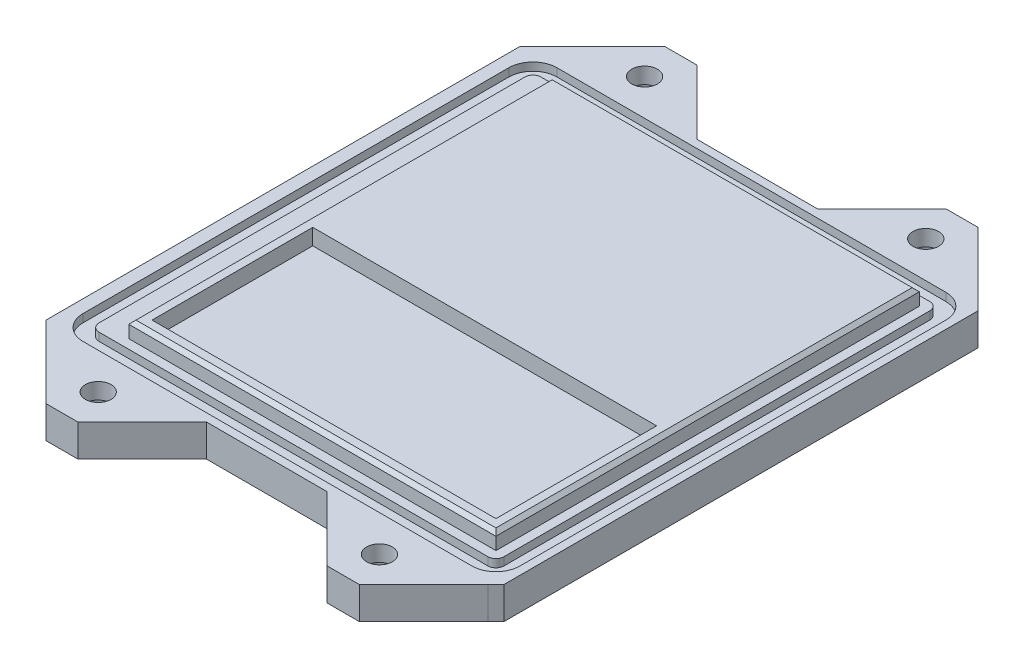
from build123d import *
from build123d.topology import SkipClean

# Parameters (mm, degrees)
SKETCH2_W           = 56
SKETCH2_H           = 61
BOSS_EXTRUDE1_DEPTH = 2
SKETCH3_W           = 46
SKETCH3_H           = 53
BOSS_EXTRUDE4_DEPTH = 2
SKETCH4_W           = 61
SKETCH4_H           = 4
BOSS_EXTRUDE5_DEPTH = 1
SKETCH5_W           = 6
SKETCH5_H           = 7
SKETCH5_R           = 1.6
BOSS_EXTRUDE7_DEPTH = 4
CUT_EXTRUDE1_DEPTH  = 1
CHAMFER1_SIZE       = 7
CHAMFER2_SIZE       = 7
CHAMFER3_SIZE       = 7
SKETCH11_R          = 3.1
CUT_EXTRUDE3_DEPTH  = 2
CHAMFER5_SIZE       = 1
BOSS_EXTRUDE8_DEPTH = 4
SKETCH13_W          = 45.8
SKETCH13_H          = 52.8
CUT_EXTRUDE4_DEPTH  = 2
CHAMFER6_SIZE       = 0.5
SKETCH14_W          = 2.229283504
SKETCH14_H          = 1.6
CUT_EXTRUDE5_DEPTH  = 0.4
CHAMFER7_SIZE       = 0.4
SKETCH15_W          = 42.8
SKETCH15_H          = 20
CUT_EXTRUDE6_DEPTH  = 2
SKETCH17_W          = 105.377924995
SKETCH17_H          = 90.385080266
SKETCH17_W_2        = 45.7
SKETCH17_H_2        = 52.7
CUT_EXTRUDE7_DEPTH  = 2
FILLET1_R           = 3
FILLET2_R           = 1


with BuildPart() as part:
    # Sketch2 → Boss-Extrude1 (new, symmetric)
    with BuildSketch(Plane(origin=(0, 0, 0), x_dir=(1, 0, 0), z_dir=(0, 1, 0))):
        with Locations((-16.78535262, 5.61968945)):
            Rectangle(SKETCH2_W, SKETCH2_H)
    extrude(amount=BOSS_EXTRUDE1_DEPTH, both=True)

    # Sketch3 → Boss-Extrude4 (add)
    with BuildSketch(Plane(origin=(0, 2, 0), x_dir=(1, 0, 0), z_dir=(0, 1, 0))):
        with Locations((-15.78535262, 5.61968945)):
            Rectangle(SKETCH3_W, SKETCH3_H)
    extrude(amount=BOSS_EXTRUDE4_DEPTH)

    # Sketch4 → Boss-Extrude5 (add)
    with BuildSketch(Plane.ZY.offset(44.78535262)):
        with Locations((-5.61968945, 0)):
            Rectangle(SKETCH4_W, SKETCH4_H)
    extrude(amount=BOSS_EXTRUDE5_DEPTH)

    # Sketch5 → Boss-Extrude7 (add)
    # profile 1 of 4: a face of its own
    with BuildSketch(Plane.XZ.offset(2)):
        with Locations((0.21464738, -39.61968945)):
            Rectangle(SKETCH5_W, SKETCH5_H)
        with Locations(Location((0.21464738, -39.61968945, 0), (0, 0, 270))):
            Circle(SKETCH5_R, mode=Mode.SUBTRACT)
    # profile 2 of 4: a face of its own
    with BuildSketch(Plane.XZ.offset(2)):
        with Locations((-34.78535262, -39.61968945)):
            Rectangle(SKETCH5_W, SKETCH5_H)
        with Locations(Location((-34.78535262, -39.61968945, 0), (0, 0, 270))):
            Circle(SKETCH5_R, mode=Mode.SUBTRACT)
    # profile 3 of 4: a face of its own
    with BuildSketch(Plane.XZ.offset(2)):
        with Locations((0.21464738, 28.38031055)):
            Rectangle(SKETCH5_W, SKETCH5_H)
        with Locations(Location((0.21464738, 28.38031055, 0), (0, 0, 270))):
            Circle(SKETCH5_R, mode=Mode.SUBTRACT)
    # profile 4 of 4: a face of its own
    with BuildSketch(Plane.XZ.offset(2)):
        with Locations((-34.78535262, 28.38031055)):
            Rectangle(SKETCH5_W, SKETCH5_H)
        with Locations(Location((-34.78535262, 28.38031055, 0), (0, 0, 270))):
            Circle(SKETCH5_R, mode=Mode.SUBTRACT)
    extrude(amount=-BOSS_EXTRUDE7_DEPTH)

    # Sketch10 → Cut-Extrude1 (cut)
    with BuildSketch(Plane(origin=(0, 2, 0), x_dir=(1, 0, 0), z_dir=(0, 1, 0))):
        Polygon((6.144593809, -23.88031055), (7.179875028, -23.88031055), (10.21464738, -23.88031055), (10.21464738, 33.074495481), (10.21464738, 35.11968945), (-41.065727012, 35.11968945), (-44.18535262, 35.11968945), (-44.18535262, -21.426384345), (-44.18535262, -23.88031055), align=None)
        Polygon((5.896683614, -21.88031055), (-42.18535262, -21.88031055), (-42.18535262, 33.11968945), (8.21464738, 33.11968945), (8.21464738, -21.88031055), align=None, mode=Mode.SUBTRACT)
    extrude(amount=-CUT_EXTRUDE1_DEPTH, mode=Mode.SUBTRACT)

    # Chamfer1
    chamfer1_edges = [part.edges().sort_by_distance(p)[0] for p in [
        (3.21464738, 0, -36.11968945),
    ]]
    chamfer(chamfer1_edges, length=CHAMFER1_SIZE - 0.0001)  # a hair under: the kernel refuses the full size

    # Chamfer2
    chamfer2_edges = [part.edges().sort_by_distance(p)[0] for p in [
        (-2.78535262, 0, -36.11968945),
    ]]
    chamfer(chamfer2_edges, length=CHAMFER2_SIZE - 0.0001)  # a hair under: the kernel refuses the full size

    # Chamfer3
    chamfer3_edges = [part.edges().sort_by_distance(p)[0] for p in [
        (-37.78535262, 0, -36.11968945),
        (-31.78535262, 0, -36.11968945),
        (3.21464738, 0, 24.88031055),
        (-2.78535262, 0, 24.88031055),
        (-37.78535262, 0, 24.88031055),
        (-31.78535262, 0, 24.88031055),
    ]]
    chamfer(chamfer3_edges, length=CHAMFER3_SIZE - 0.0001)  # a hair under: the kernel refuses the full size

    # Sketch11 → Cut-Extrude3 (cut)
    with BuildSketch(Plane.XZ.offset(2)):
        with Locations(Location((-34.78535262, 28.38031055, 0), (0, 0, 270))):
            Circle(SKETCH11_R)
        with Locations(Location((0.21464738, 28.38031055, 0), (0, 0, 270))):
            Circle(SKETCH11_R)
        with Locations(Location((0.21464738, -39.61968945, 0), (0, 0, 270))):
            Circle(SKETCH11_R)
        with Locations(Location((-34.78535262, -39.61968945, 0), (0, 0, 270))):
            Circle(SKETCH11_R)
    extrude(amount=-CUT_EXTRUDE3_DEPTH, mode=Mode.SUBTRACT)

    # Chamfer5
    chamfer5_edges = [part.edges().sort_by_distance(p)[0] for p in [
        (-45.78535262, 0, -36.11968945),
        (-45.78535262, 0, 24.88031055),
        (11.21464738, 0, -36.11968945),
        (11.21464738, 0, 24.88031055),
    ]]
    chamfer(chamfer5_edges, length=CHAMFER5_SIZE)

    # Sketch12 → Boss-Extrude8 (add)
    with SkipClean():  # the faces are left unmerged after this step: merging them gives an invalid solid
        with BuildSketch(Plane.XZ.offset(2)):
            Polygon((-31.78535262, 31.88031055), (-32.78535262, 32.88031055), (-36.78535262, 32.88031055), (-37.78535262, 31.88031055), align=None)
            Polygon((3.21464738, 31.88031055), (2.21464738, 32.88031055), (-1.78535262, 32.88031055), (-2.78535262, 31.88031055), align=None)
            Polygon((-2.78535262, -43.11968945), (-1.78535262, -44.11968945), (-1.009776474, -44.11968945), (2.21464738, -44.11968945), (3.21464738, -43.11968945), align=None)
            Polygon((-31.78535262, -43.11968945), (-32.78535262, -44.11968945), (-36.78535262, -44.11968945), (-37.78535262, -43.11968945), align=None)
        extrude(amount=-BOSS_EXTRUDE8_DEPTH)

    # Sketch13 → Cut-Extrude4 (cut)
    with SkipClean():  # the faces are left unmerged after this step: merging them gives an invalid solid
        with BuildSketch(Plane(origin=(0, 4, 0), x_dir=(1, 0, 0), z_dir=(0, 1, 0))):
            Polygon((-38.78535262, -20.88031055), (-38.68535262, -20.88031055), (7.21464738, -20.88031055), (7.21464738, -20.78031055), (7.21464738, 32.01968945), (7.21464738, 32.11968945), (-38.68535262, 32.11968945), (-38.78535262, 32.11968945), align=None)
            with Locations((-15.78535262, 5.61968945)):
                Rectangle(SKETCH13_W, SKETCH13_H, mode=Mode.SUBTRACT)
        extrude(amount=-CUT_EXTRUDE4_DEPTH, mode=Mode.SUBTRACT)

    # Chamfer6
    chamfer6_edges = [part.edges().sort_by_distance(p)[0] for p in [
        (-15.78535262, 4, 20.78031055),
        (-38.68535262, 4, -5.61968945),
        (-15.78535262, 4, -32.01968945),
        (7.11464738, 4, -5.61968945),
    ]]
    chamfer(chamfer6_edges, length=CHAMFER6_SIZE)

    # Sketch14 → Cut-Extrude5 (cut)
    with SkipClean():  # the faces are left unmerged after this step: merging them gives an invalid solid
        with BuildSketch(Plane.XZ.offset(2)):
            with Locations((-40.670710868, -5.61968945)):
                Rectangle(SKETCH14_W, SKETCH14_H)
        extrude(amount=-CUT_EXTRUDE5_DEPTH, mode=Mode.SUBTRACT)

    # Chamfer7
    chamfer7_edges = [part.edges().sort_by_distance(p)[0] for p in [
        (-40.670710868, -1.6, -4.81968945),
        (-39.556069116, -1.6, -5.61968945),
        (-40.670710868, -1.6, -6.41968945),
        (-41.78535262, -1.6, -5.61968945),
    ]]
    chamfer(chamfer7_edges, length=CHAMFER7_SIZE - 0.0001)  # a hair under: the kernel refuses the full size

    # Sketch15 → Cut-Extrude6 (cut)
    with SkipClean():  # the faces are left unmerged after this step: merging them gives an invalid solid
        with BuildSketch(Plane(origin=(0, 4, 0), x_dir=(1, 0, 0), z_dir=(0, 1, 0))):
            with Locations((-15.78535262, -9.28031055)):
                Rectangle(SKETCH15_W, SKETCH15_H)
        extrude(amount=-CUT_EXTRUDE6_DEPTH, mode=Mode.SUBTRACT)

    # Sketch17 → Cut-Extrude7 (cut)
    with SkipClean():  # the faces are left unmerged after this step: merging them gives an invalid solid
        with BuildSketch(Plane(origin=(0, 4, 0), x_dir=(1, 0, 0), z_dir=(0, 1, 0))):
            with Locations((-12.998639351, 5.588523168)):
                Rectangle(SKETCH17_W, SKETCH17_H)
            with Locations((-15.78535262, 5.61968945)):
                Rectangle(SKETCH17_W_2, SKETCH17_H_2, mode=Mode.SUBTRACT)
        extrude(amount=-CUT_EXTRUDE7_DEPTH, mode=Mode.SUBTRACT)

    # Fillet1
    fillet1_edges = [part.edges().sort_by_distance(p)[0] for p in [
        (-44.18535262, 1.5, 23.88031055),
        (-44.18535262, 1.5, -35.11968945),
        (10.21464738, 1.5, -35.11968945),
        (10.21464738, 1.5, 23.88031055),
    ]]
    fillet(fillet1_edges, radius=FILLET1_R)

    # Fillet2
    fillet2_edges = [part.edges().sort_by_distance(p)[0] for p in [
        (-42.18535262, 1.5, 21.88031055),
        (-42.18535262, 1.5, -33.11968945),
        (8.21464738, 1.5, -33.11968945),
        (8.21464738, 1.5, 21.88031055),
    ]]
    fillet(fillet2_edges, radius=FILLET2_R)


solid = part.part
